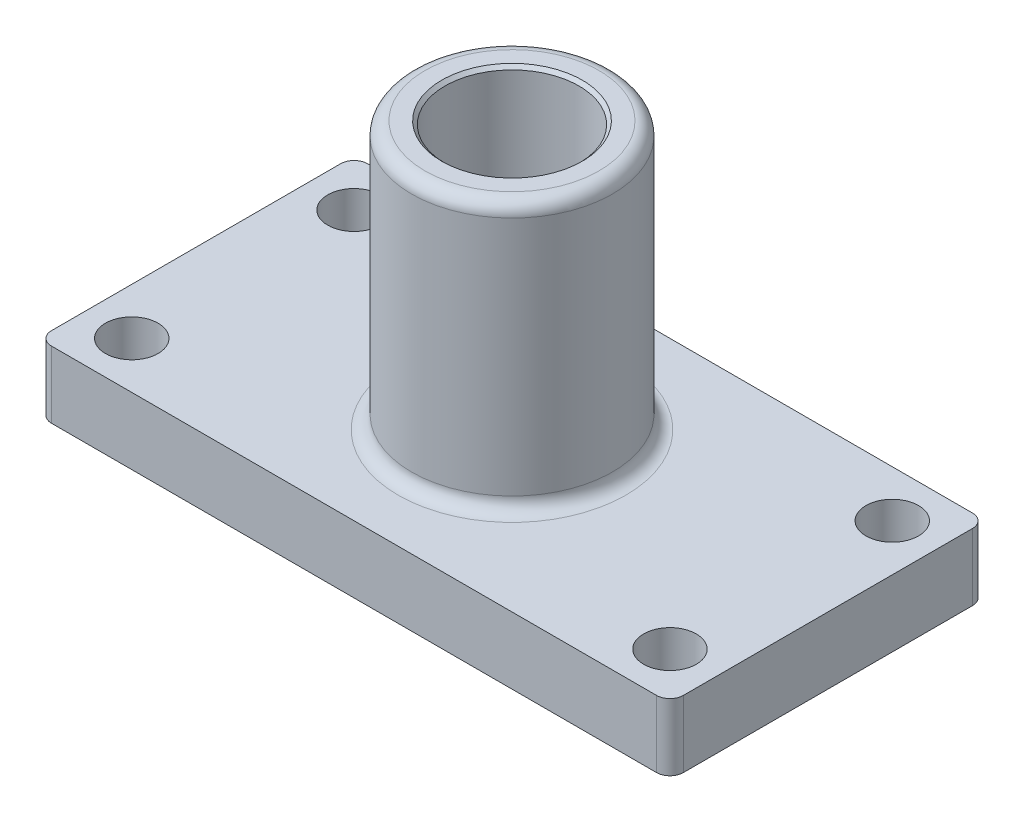
from build123d import *

# Parameters (mm, degrees)
SKETCH1_W           = 59.999999888
SKETCH1_H           = 29.999999944
SKETCH1_R           = 2.499999953
SKETCH1_R_2         = 6.35889
BOSS_EXTRUDE1_DEPTH = 6.35
SKETCH2_R           = 9.53389
SKETCH2_R_2         = 6.35889
BOSS_EXTRUDE2_DEPTH = 25.4
FILLET1_R           = 1.27
CHAMFER5_SIZE       = 0.3175


with BuildPart() as part:
    # Sketch1 → Boss-Extrude1 (new body)
    with BuildSketch(Plane(origin=(0, 0, 0), x_dir=(1, 0, 0), z_dir=(0, 1, 0))):
        Rectangle(SKETCH1_W, SKETCH1_H)
        with Locations((-25.554999944, 10.554999972)):
            Circle(SKETCH1_R, mode=Mode.SUBTRACT)
        with Locations((25.554999944, 10.554999972)):
            Circle(SKETCH1_R, mode=Mode.SUBTRACT)
        with Locations((25.554999944, -10.554999972)):
            Circle(SKETCH1_R, mode=Mode.SUBTRACT)
        with Locations((-25.554999944, -10.554999972)):
            Circle(SKETCH1_R, mode=Mode.SUBTRACT)
        Circle(SKETCH1_R_2, mode=Mode.SUBTRACT)
    extrude(amount=BOSS_EXTRUDE1_DEPTH)

    # Sketch2 → Boss-Extrude2 (add)
    with BuildSketch(Plane(origin=(0, 6.35, 0), x_dir=(1, 0, 0), z_dir=(0, 1, 0))):
        Circle(SKETCH2_R)
        Circle(SKETCH2_R_2, mode=Mode.SUBTRACT)
    extrude(amount=BOSS_EXTRUDE2_DEPTH)

    # Fillet1
    fillet1_edges = [part.edges().sort_by_distance(p)[0] for p in [
        (-9.53389, 31.75, 0),
        (-9.53389, 6.35, 0),
        (-29.999999944, 3.175, -14.999999972),
        (-29.999999944, 3.175, 14.999999972),
        (29.999999944, 3.175, -14.999999972),
        (29.999999944, 3.175, 14.999999972),
    ]]
    fillet(fillet1_edges, radius=FILLET1_R)

    # Chamfer5
    chamfer5_edges = [part.edges().sort_by_distance(p)[0] for p in [
        (-6.35889, 31.75, 0),
    ]]
    chamfer(chamfer5_edges, length=CHAMFER5_SIZE)


solid = part.part
